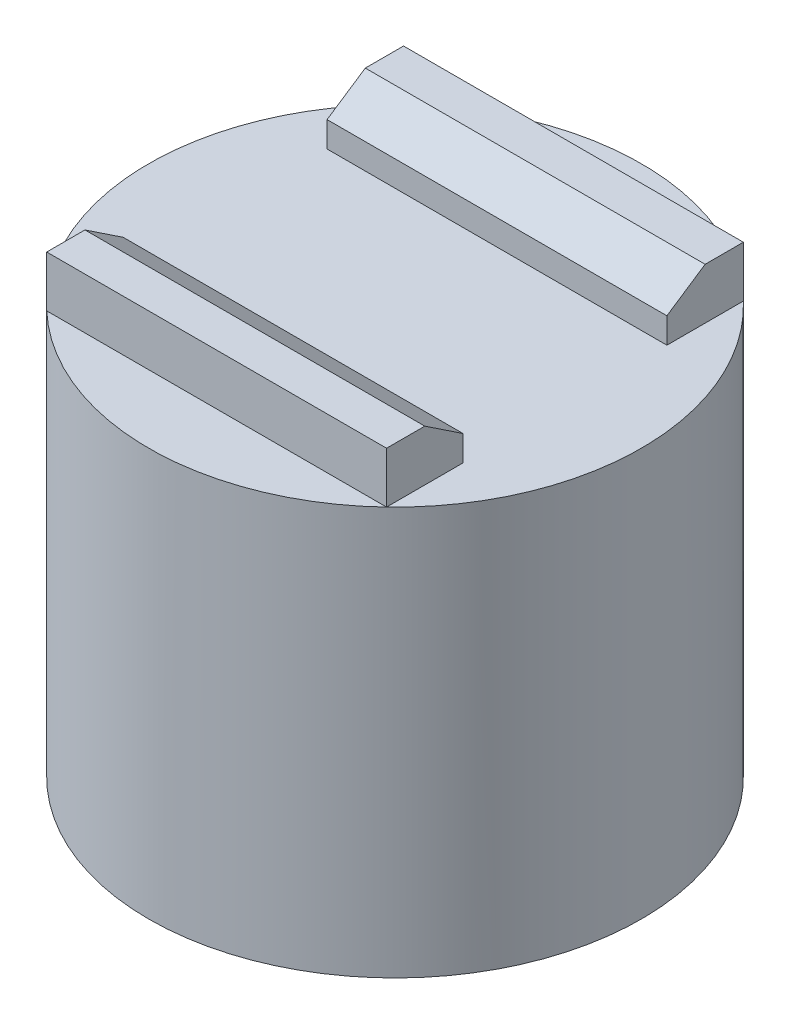
from build123d import *

# Parameters (mm, degrees)
SKETCH1_R           = 14.5
BOSS_EXTRUDE1_DEPTH = 24
SKETCH2_W           = 20
SKETCH2_H           = 4.5
BOSS_EXTRUDE2_DEPTH = 3
CUT_EXTRUDE1_DEPTH  = 43
SKETCH4_R           = 2.5
CUT_EXTRUDE2_DEPTH  = 7


with BuildPart() as part:
    # Sketch1 → Boss-Extrude1 (new body)
    with BuildSketch(Plane(origin=(0, 0, 0), x_dir=(1, 0, 0), z_dir=(0, 1, 0))):
        Circle(SKETCH1_R)
    extrude(amount=BOSS_EXTRUDE1_DEPTH)

    # Sketch2 → Boss-Extrude2 (add)
    with BuildSketch(Plane(origin=(0, 24, 0), x_dir=(1, 0, 0), z_dir=(0, 1, 0))):
        with Locations((0, 8.25)):
            Rectangle(SKETCH2_W, SKETCH2_H)
    extrude(amount=BOSS_EXTRUDE2_DEPTH)

    # Sketch3 → Cut-Extrude1 (cut)
    with BuildSketch(Plane(origin=(10, 0, 0), x_dir=(0, 0, -1), z_dir=(1, 0, 0))):
        Polygon((6, 25.5), (8.25, 27), (6, 27), align=None)
    extrude(amount=-CUT_EXTRUDE1_DEPTH, mode=Mode.SUBTRACT)

    # Mirror1: part across plane


with BuildPart() as part_1:
    add(part.part)
    add(part.part.mirror(Plane.XY))

    # Sketch4 → Cut-Extrude2 (cut)
    with BuildSketch(Plane.XZ):
        Circle(SKETCH4_R)
    extrude(amount=-CUT_EXTRUDE2_DEPTH, mode=Mode.SUBTRACT)


solid = part_1.part
